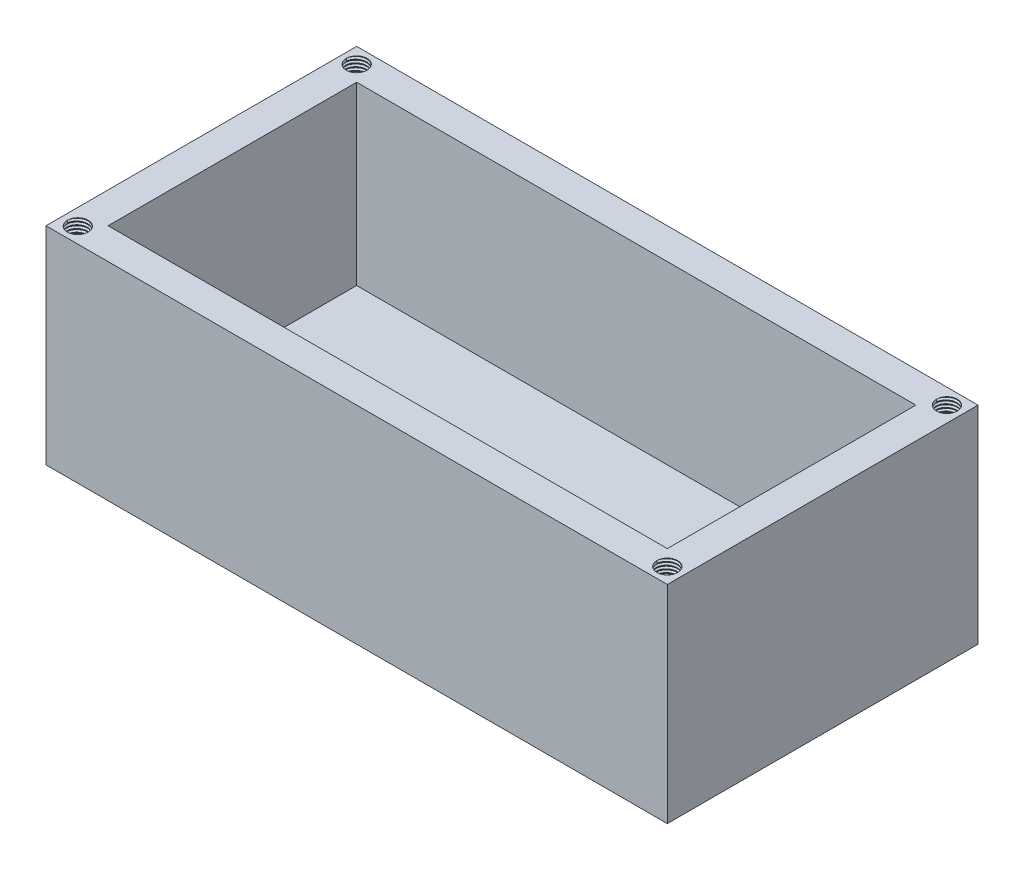
from build123d import *
from build123d.topology import SkipClean

# Parameters (mm, degrees)
SKETCH2_W           = 76.2
SKETCH2_H           = 38.1
BOSS_EXTRUDE1_DEPTH = 25.4
SHELL1_T            = -3.81
SKETCH3_R           = 3.175
SKETCH3_R_2         = 1.651
CUT_EXTRUDE1_DEPTH  = 3.81
SKETCH4_R           = 1.27
CUT_EXTRUDE2_DEPTH  = 2.54
THREAD1_PITCH       = 0.396875
THREAD2_PITCH       = 0.396875
THREAD3_PITCH       = 0.396875
THREAD4_PITCH       = 0.396875


with BuildPart() as part:
    # Sketch2 → Boss-Extrude1 (new body)
    with BuildSketch(Plane(origin=(0, 0, 0), x_dir=(1, 0, 0), z_dir=(0, 1, 0))):
        Rectangle(SKETCH2_W, SKETCH2_H)
    extrude(amount=BOSS_EXTRUDE1_DEPTH)

    # Shell1
    shell1_openings = [part.faces().sort_by_distance(p)[0] for p in [
        (0, 25.4, 0),
    ]]
    offset(amount=SHELL1_T, openings=shell1_openings, kind=Kind.INTERSECTION)

    # Sketch3 → Cut-Extrude1 (cut)
    with BuildSketch(Plane(origin=(0, 3.81, 0), x_dir=(1, 0, 0), z_dir=(0, 1, 0))):
        with Locations(Location((-12.833634545, 0, 0), (0, 0, 270))):
            Circle(SKETCH3_R)
        with Locations(Location((4.628865455, 0, 0), (0, 0, 270))):
            Circle(SKETCH3_R_2)
    extrude(amount=-CUT_EXTRUDE1_DEPTH, mode=Mode.SUBTRACT)

    # Sketch4 → Cut-Extrude2 (cut)
    with BuildSketch(Plane(origin=(0, 25.4, 0), x_dir=(1, 0, 0), z_dir=(0, 1, 0))):
        with Locations(Location((-36.195, 17.145, 0), (0, 0, 270))):
            Circle(SKETCH4_R)
        with Locations(Location((36.195, 17.145, 0), (0, 0, 270))):
            Circle(SKETCH4_R)
        with Locations(Location((36.195, -17.145, 0), (0, 0, 270))):
            Circle(SKETCH4_R)
        with Locations(Location((-36.105951742, -17.145, 0), (0, 0, 270))):
            Circle(SKETCH4_R)
    extrude(amount=-CUT_EXTRUDE2_DEPTH, mode=Mode.SUBTRACT)

    # Thread1: the profile of Thread Profile1 profile screwed along a right-hand helix of 6.4 turns, 6 arcs to a turn; built about Z, then put on its axis
    with SkipClean():  # the faces are left unmerged after this step: merging them gives an invalid solid
        thread1_z = Axis((0, 0, 0), (0, 0, 1))
        thread1_corners = [(1.2697, 0, -0.000173205), (1.484814894, 0, 0.124023437), (1.484814894, 0, 0.173632812), (1.2697, 0, 0.297829454)]
        with BuildLine(mode=Mode.PRIVATE) as thread1_profile:
            Line(thread1_corners[0], thread1_corners[1])
            Line(thread1_corners[1], thread1_corners[2])
            Line(thread1_corners[2], thread1_corners[3])
            Line(thread1_corners[3], thread1_corners[0])
        thread1_cap = Face(thread1_profile.wire())
        thread1_turn_angles = [0, 30, 60, 90, 120, 150, 180, 210, 240, 270, 300, 330, 360]
        thread1_turn_weights = [1, 0.8660254037844387, 1, 0.8660254037844387, 1, 0.8660254037844387, 1, 0.8660254037844387, 1, 0.8660254037844387, 1, 0.8660254037844387, 1]
        thread1_turn_rails = [Edge.make_bspline([Vector(p[0], p[1], 0).rotate(thread1_z, thread1_turn_angles[k]) / thread1_turn_weights[k] + Vector(0, 0, p[2] + THREAD1_PITCH * thread1_turn_angles[k] / 360) for k in range(13)], [0, 0, 0, 1, 1, 2, 2, 3, 3, 4, 4, 5, 5, 6, 6, 6], 2, thread1_turn_weights) for p in thread1_corners]
        thread1_turn_sides = [Face.make_surface_from_curves(thread1_turn_rails[p[0]], thread1_turn_rails[p[1]]) for p in [(0, 1), (1, 2), (2, 3), (3, 0)]]
        thread1_last_angles = [2160, 2190, 2220, 2250, 2280, 2292, 2304]
        thread1_last_weights = [1, 0.8660254037844387, 1, 0.8660254037844387, 1, 0.9781476007338048, 1]
        thread1_last_rails = [Edge.make_bspline([Vector(p[0], p[1], 0).rotate(thread1_z, thread1_last_angles[k]) / thread1_last_weights[k] + Vector(0, 0, p[2] + THREAD1_PITCH * thread1_last_angles[k] / 360) for k in range(7)], [0, 0, 0, 1, 1, 2, 2, 3, 3, 3], 2, thread1_last_weights) for p in thread1_corners]
        thread1_last_sides = [Face.make_surface_from_curves(thread1_last_rails[p[0]], thread1_last_rails[p[1]]) for p in [(0, 1), (1, 2), (2, 3), (3, 0)]]
        thread1 = Plane(origin=(-36.195, 25.4, -17.145), x_dir=(-1, 0, 0), z_dir=(0, -1, 0)) * Solid(Shell([*[p.moved(Location((0, 0, THREAD1_PITCH * i))) for i in range(6) for p in thread1_turn_sides], *thread1_last_sides, thread1_cap, thread1_cap.rotate(thread1_z, 2304).moved(Location((0, 0, THREAD1_PITCH * 2304 / 360)))]))
        add(thread1, mode=Mode.SUBTRACT)

    # Thread2: the profile of Thread Profile2 profile screwed along a right-hand helix of 6.4 turns, 6 arcs to a turn; built about Z, then put on its axis
    with SkipClean():  # the faces are left unmerged after this step: merging them gives an invalid solid
        thread2_z = Axis((0, 0, 0), (0, 0, 1))
        thread2_corners = [(1.2697, 0, -0.000173205), (1.484814894, 0, 0.124023437), (1.484814894, 0, 0.173632812), (1.2697, 0, 0.297829454)]
        with BuildLine(mode=Mode.PRIVATE) as thread2_profile:
            Line(thread2_corners[0], thread2_corners[1])
            Line(thread2_corners[1], thread2_corners[2])
            Line(thread2_corners[2], thread2_corners[3])
            Line(thread2_corners[3], thread2_corners[0])
        thread2_cap = Face(thread2_profile.wire())
        thread2_turn_angles = [0, 30, 60, 90, 120, 150, 180, 210, 240, 270, 300, 330, 360]
        thread2_turn_weights = [1, 0.8660254037844387, 1, 0.8660254037844387, 1, 0.8660254037844387, 1, 0.8660254037844387, 1, 0.8660254037844387, 1, 0.8660254037844387, 1]
        thread2_turn_rails = [Edge.make_bspline([Vector(p[0], p[1], 0).rotate(thread2_z, thread2_turn_angles[k]) / thread2_turn_weights[k] + Vector(0, 0, p[2] + THREAD2_PITCH * thread2_turn_angles[k] / 360) for k in range(13)], [0, 0, 0, 1, 1, 2, 2, 3, 3, 4, 4, 5, 5, 6, 6, 6], 2, thread2_turn_weights) for p in thread2_corners]
        thread2_turn_sides = [Face.make_surface_from_curves(thread2_turn_rails[p[0]], thread2_turn_rails[p[1]]) for p in [(0, 1), (1, 2), (2, 3), (3, 0)]]
        thread2_last_angles = [2160, 2190, 2220, 2250, 2280, 2292, 2304]
        thread2_last_weights = [1, 0.8660254037844387, 1, 0.8660254037844387, 1, 0.9781476007338048, 1]
        thread2_last_rails = [Edge.make_bspline([Vector(p[0], p[1], 0).rotate(thread2_z, thread2_last_angles[k]) / thread2_last_weights[k] + Vector(0, 0, p[2] + THREAD2_PITCH * thread2_last_angles[k] / 360) for k in range(7)], [0, 0, 0, 1, 1, 2, 2, 3, 3, 3], 2, thread2_last_weights) for p in thread2_corners]
        thread2_last_sides = [Face.make_surface_from_curves(thread2_last_rails[p[0]], thread2_last_rails[p[1]]) for p in [(0, 1), (1, 2), (2, 3), (3, 0)]]
        thread2 = Plane(origin=(-36.105951742, 25.4, 17.145), x_dir=(-1, 0, 0), z_dir=(0, -1, 0)) * Solid(Shell([*[p.moved(Location((0, 0, THREAD2_PITCH * i))) for i in range(6) for p in thread2_turn_sides], *thread2_last_sides, thread2_cap, thread2_cap.rotate(thread2_z, 2304).moved(Location((0, 0, THREAD2_PITCH * 2304 / 360)))]))
        add(thread2, mode=Mode.SUBTRACT)

    # Thread3: the profile of Thread Profile3 profile screwed along a right-hand helix of 6.4 turns, 6 arcs to a turn; built about Z, then put on its axis
    with SkipClean():  # the faces are left unmerged after this step: merging them gives an invalid solid
        thread3_z = Axis((0, 0, 0), (0, 0, 1))
        thread3_corners = [(1.2697, 0, -0.000173205), (1.484814894, 0, 0.124023437), (1.484814894, 0, 0.173632812), (1.2697, 0, 0.297829454)]
        with BuildLine(mode=Mode.PRIVATE) as thread3_profile:
            Line(thread3_corners[0], thread3_corners[1])
            Line(thread3_corners[1], thread3_corners[2])
            Line(thread3_corners[2], thread3_corners[3])
            Line(thread3_corners[3], thread3_corners[0])
        thread3_cap = Face(thread3_profile.wire())
        thread3_turn_angles = [0, 30, 60, 90, 120, 150, 180, 210, 240, 270, 300, 330, 360]
        thread3_turn_weights = [1, 0.8660254037844387, 1, 0.8660254037844387, 1, 0.8660254037844387, 1, 0.8660254037844387, 1, 0.8660254037844387, 1, 0.8660254037844387, 1]
        thread3_turn_rails = [Edge.make_bspline([Vector(p[0], p[1], 0).rotate(thread3_z, thread3_turn_angles[k]) / thread3_turn_weights[k] + Vector(0, 0, p[2] + THREAD3_PITCH * thread3_turn_angles[k] / 360) for k in range(13)], [0, 0, 0, 1, 1, 2, 2, 3, 3, 4, 4, 5, 5, 6, 6, 6], 2, thread3_turn_weights) for p in thread3_corners]
        thread3_turn_sides = [Face.make_surface_from_curves(thread3_turn_rails[p[0]], thread3_turn_rails[p[1]]) for p in [(0, 1), (1, 2), (2, 3), (3, 0)]]
        thread3_last_angles = [2160, 2190, 2220, 2250, 2280, 2292, 2304]
        thread3_last_weights = [1, 0.8660254037844387, 1, 0.8660254037844387, 1, 0.9781476007338048, 1]
        thread3_last_rails = [Edge.make_bspline([Vector(p[0], p[1], 0).rotate(thread3_z, thread3_last_angles[k]) / thread3_last_weights[k] + Vector(0, 0, p[2] + THREAD3_PITCH * thread3_last_angles[k] / 360) for k in range(7)], [0, 0, 0, 1, 1, 2, 2, 3, 3, 3], 2, thread3_last_weights) for p in thread3_corners]
        thread3_last_sides = [Face.make_surface_from_curves(thread3_last_rails[p[0]], thread3_last_rails[p[1]]) for p in [(0, 1), (1, 2), (2, 3), (3, 0)]]
        thread3 = Plane(origin=(36.195, 25.4, 17.145), x_dir=(-1, 0, 0), z_dir=(0, -1, 0)) * Solid(Shell([*[p.moved(Location((0, 0, THREAD3_PITCH * i))) for i in range(6) for p in thread3_turn_sides], *thread3_last_sides, thread3_cap, thread3_cap.rotate(thread3_z, 2304).moved(Location((0, 0, THREAD3_PITCH * 2304 / 360)))]))
        add(thread3, mode=Mode.SUBTRACT)

    # Thread4: the profile of Thread Profile4 profile screwed along a right-hand helix of 6.4 turns, 6 arcs to a turn; built about Z, then put on its axis
    with SkipClean():  # the faces are left unmerged after this step: merging them gives an invalid solid
        thread4_z = Axis((0, 0, 0), (0, 0, 1))
        thread4_corners = [(1.2697, 0, -0.000173205), (1.484814894, 0, 0.124023437), (1.484814894, 0, 0.173632812), (1.2697, 0, 0.297829454)]
        with BuildLine(mode=Mode.PRIVATE) as thread4_profile:
            Line(thread4_corners[0], thread4_corners[1])
            Line(thread4_corners[1], thread4_corners[2])
            Line(thread4_corners[2], thread4_corners[3])
            Line(thread4_corners[3], thread4_corners[0])
        thread4_cap = Face(thread4_profile.wire())
        thread4_turn_angles = [0, 30, 60, 90, 120, 150, 180, 210, 240, 270, 300, 330, 360]
        thread4_turn_weights = [1, 0.8660254037844387, 1, 0.8660254037844387, 1, 0.8660254037844387, 1, 0.8660254037844387, 1, 0.8660254037844387, 1, 0.8660254037844387, 1]
        thread4_turn_rails = [Edge.make_bspline([Vector(p[0], p[1], 0).rotate(thread4_z, thread4_turn_angles[k]) / thread4_turn_weights[k] + Vector(0, 0, p[2] + THREAD4_PITCH * thread4_turn_angles[k] / 360) for k in range(13)], [0, 0, 0, 1, 1, 2, 2, 3, 3, 4, 4, 5, 5, 6, 6, 6], 2, thread4_turn_weights) for p in thread4_corners]
        thread4_turn_sides = [Face.make_surface_from_curves(thread4_turn_rails[p[0]], thread4_turn_rails[p[1]]) for p in [(0, 1), (1, 2), (2, 3), (3, 0)]]
        thread4_last_angles = [2160, 2190, 2220, 2250, 2280, 2292, 2304]
        thread4_last_weights = [1, 0.8660254037844387, 1, 0.8660254037844387, 1, 0.9781476007338048, 1]
        thread4_last_rails = [Edge.make_bspline([Vector(p[0], p[1], 0).rotate(thread4_z, thread4_last_angles[k]) / thread4_last_weights[k] + Vector(0, 0, p[2] + THREAD4_PITCH * thread4_last_angles[k] / 360) for k in range(7)], [0, 0, 0, 1, 1, 2, 2, 3, 3, 3], 2, thread4_last_weights) for p in thread4_corners]
        thread4_last_sides = [Face.make_surface_from_curves(thread4_last_rails[p[0]], thread4_last_rails[p[1]]) for p in [(0, 1), (1, 2), (2, 3), (3, 0)]]
        thread4 = Plane(origin=(36.195, 25.4, -17.145), x_dir=(-1, 0, 0), z_dir=(0, -1, 0)) * Solid(Shell([*[p.moved(Location((0, 0, THREAD4_PITCH * i))) for i in range(6) for p in thread4_turn_sides], *thread4_last_sides, thread4_cap, thread4_cap.rotate(thread4_z, 2304).moved(Location((0, 0, THREAD4_PITCH * 2304 / 360)))]))
        add(thread4, mode=Mode.SUBTRACT)


solid = part.part
